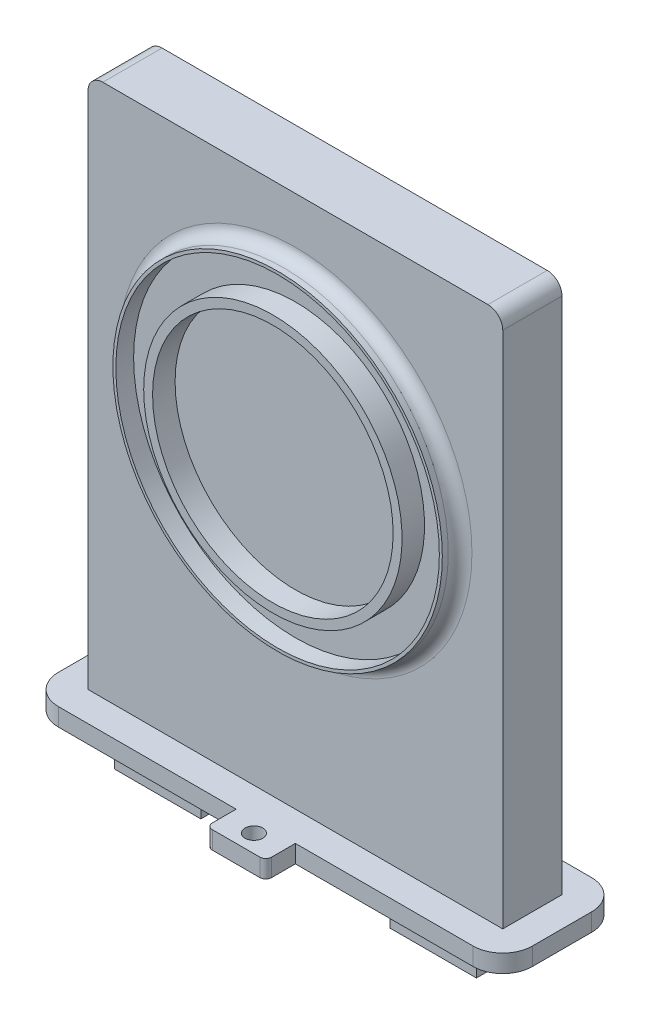
from build123d import *

# Parameters (mm, degrees)
SKETCH1_W           = 70
SKETCH1_H           = 110.7
BOSS_EXTRUDE1_DEPTH = 10
BOSS_EXTRUDE3_DEPTH = 10
SKETCH4_R           = 1.5
SKETCH4_W           = 70
SKETCH4_H           = 10
BOSS_EXTRUDE4_DEPTH = 3
SKETCH5_R           = 27.8
SKETCH5_R_2         = 27.3
BOSS_EXTRUDE5_DEPTH = 3
FILLET2_R           = 2
SKETCH10_R          = 21.8
SKETCH10_R_2        = 20.3
BOSS_EXTRUDE7_DEPTH = 3.8
CUT_EXTRUDE1_REACH  = 78.243
SKETCH11_W          = 70
SKETCH11_H          = 17.7
FILLET3_R           = 2.5


with BuildPart() as part:
    # Sketch1 → Boss-Extrude1 (new body)
    with BuildSketch(Plane.XY):
        Rectangle(SKETCH1_W, SKETCH1_H)
    extrude(amount=BOSS_EXTRUDE1_DEPTH)

    # Sketch3 → Boss-Extrude3 (add)
    with BuildSketch(Plane(origin=(0, 0, 0), x_dir=(-1, 0, 0), z_dir=(0, 0, -1))):
        Polygon((-20.95, -59.05), (-15.95, -59.05), (-15.95, -61.75), (-30.55, -61.75), (-30.55, -59.05), (-25.55, -59.05), (-25.55, -55.35), (-20.95, -55.35), align=None)
        Polygon((30.55, -59.05), (30.55, -61.75), (15.95, -61.75), (15.95, -59.05), (20.95, -59.05), (20.95, -55.35), (25.55, -55.35), (25.55, -59.05), align=None)
    extrude(amount=-BOSS_EXTRUDE3_DEPTH)

    # Sketch4 → Boss-Extrude4 (add)
    with BuildSketch(Plane.XZ.offset(55.35)):
        with BuildLine():
            Line((5, -5), (35, -5))
            ThreePointArc((35, -5), (38.535533906, -3.535533906), (40, 0))
            Line((40, 0), (40, 10))
            ThreePointArc((40, 10), (38.535533906, 13.535533906), (35, 15))
            Line((35, 15), (5, 15))
            Line((5, 15), (5, 19))
            ThreePointArc((5, 19), (4.707106781, 19.707106781), (4, 20))
            Line((4, 20), (-4, 20))
            ThreePointArc((-4, 20), (-4.707106781, 19.707106781), (-5, 19))
            Line((-5, 19), (-5, 15))
            Line((-5, 15), (-35, 15))
            ThreePointArc((-35, 15), (-38.535533906, 13.535533906), (-40, 10))
            Line((-40, 10), (-40, 0))
            ThreePointArc((-40, 0), (-38.535533906, -3.535533906), (-35, -5))
            Line((-35, -5), (-5, -5))
            Line((-5, -5), (-5, -9))
            ThreePointArc((-5, -9), (-4.707106781, -9.707106781), (-4, -10))
            Line((-4, -10), (4, -10))
            ThreePointArc((4, -10), (4.707106781, -9.707106781), (5, -9))
            Line((5, -9), (5, -5))
        make_face()
        with Locations((0, -7)):
            Circle(SKETCH4_R, mode=Mode.SUBTRACT)
        with Locations((0, 17)):
            Circle(SKETCH4_R, mode=Mode.SUBTRACT)
        with Locations((0, 5)):
            Rectangle(SKETCH4_W, SKETCH4_H, mode=Mode.SUBTRACT)
    extrude(amount=-BOSS_EXTRUDE4_DEPTH)

    # Sketch5 → Boss-Extrude5 (add)
    with BuildSketch(Plane.XY.offset(10)):
        Circle(SKETCH5_R)
        Circle(SKETCH5_R_2, mode=Mode.SUBTRACT)
    extrude(amount=BOSS_EXTRUDE5_DEPTH)

    # Fillet2
    fillet2_edges = [part.edges().sort_by_distance(p)[0] for p in [
        (-27.8, 0, 10),
    ]]
    fillet(fillet2_edges, radius=FILLET2_R)

    # Sketch10 → Boss-Extrude7 (add)
    with BuildSketch(Plane.XY.offset(10)):
        Circle(SKETCH10_R)
        Circle(SKETCH10_R_2, mode=Mode.SUBTRACT)
    extrude(amount=BOSS_EXTRUDE7_DEPTH)

    # Sketch11 → Cut-Extrude1 (cut, up to next)
    with BuildSketch(Plane.XY.offset(10), mode=Mode.PRIVATE) as cut_extrude1_sk1:
        with Locations((0, 46.5)):
            Rectangle(SKETCH11_W, SKETCH11_H)
    cut_extrude1_tool1 = extrude(cut_extrude1_sk1.sketch, amount=-CUT_EXTRUDE1_REACH, mode=Mode.PRIVATE) & part.part
    add(cut_extrude1_tool1.solids().sort_by_distance((0, 46.5, 10))[0], mode=Mode.SUBTRACT)

    # Fillet3
    fillet3_edges = [part.edges().sort_by_distance(p)[0] for p in [
        (35, 37.65, 5),
        (-35, 37.65, 5),
    ]]
    fillet(fillet3_edges, radius=FILLET3_R)


solid = part.part
